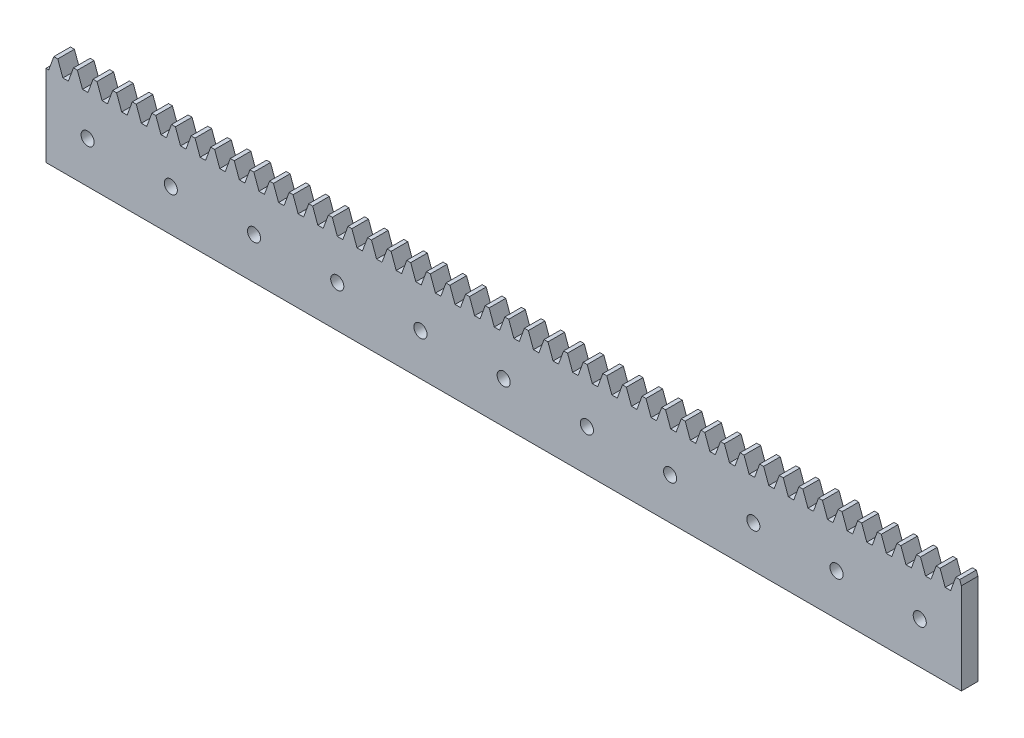
from build123d import *

# Parameters (mm, degrees)
BLANKSKE_W          = 660
BLANKSKE_H          = 23
BLANK_DEPTH         = 4
TOOTHCUTSIM_DEPTH   = 661.412749726
TEETHCUTS_COUNT     = 142
TEETHCUTS_PITCH     = 4.712388975
SKETCH_2_R          = 1.575
CUT_EXTRUDE_2_DEPTH = 661.412749726
SKETCH_3_W          = 440
SKETCH_3_H          = 65.547839675
CUT_EXTRUDE_3_DEPTH = 661.412749726


with BuildPart() as part:
    # BlankSke → Blank (new body)
    with BuildSketch(Plane.XY):
        with Locations((330, 11.5)):
            Rectangle(BLANKSKE_W, BLANKSKE_H)
    extrude(amount=-BLANK_DEPTH)

    # TooCutSkeSim → ToothCutSim (cut, through all)
    with BuildSketch(Plane.XY):
        Polygon((0.654653055, 19.625), (-0.654653055, 19.625), (-1.892297439, 23.0254), (1.892297439, 23.0254), align=None)
    toothcutsim = extrude(amount=-TOOTHCUTSIM_DEPTH, mode=Mode.SUBTRACT)

    # TeethCuts: ToothCutSim ×142
    with Locations(*[(i * TEETHCUTS_PITCH, 0, 0) for i in range(1, TEETHCUTS_COUNT)]):
        add(toothcutsim, mode=Mode.SUBTRACT)

    # 草图2 → 切除-拉伸2 (cut, through all)
    with BuildSketch(Plane.XY):
        with Locations((650, 10)):
            Circle(SKETCH_2_R)
        with Locations((630, 10)):
            Circle(SKETCH_2_R)
        with Locations((610, 10)):
            Circle(SKETCH_2_R)
        with Locations((590, 10)):
            Circle(SKETCH_2_R)
        with Locations((570, 10)):
            Circle(SKETCH_2_R)
        with Locations((550, 10)):
            Circle(SKETCH_2_R)
        with Locations((530, 10)):
            Circle(SKETCH_2_R)
        with Locations((510, 10)):
            Circle(SKETCH_2_R)
        with Locations((490, 10)):
            Circle(SKETCH_2_R)
        with Locations((470, 10)):
            Circle(SKETCH_2_R)
        with Locations((450, 10)):
            Circle(SKETCH_2_R)
        with Locations((430, 10)):
            Circle(SKETCH_2_R)
        with Locations((410, 10)):
            Circle(SKETCH_2_R)
        with Locations((390, 10)):
            Circle(SKETCH_2_R)
        with Locations((370, 10)):
            Circle(SKETCH_2_R)
        with Locations((350, 10)):
            Circle(SKETCH_2_R)
        with Locations((330, 10)):
            Circle(SKETCH_2_R)
        with Locations((310, 10)):
            Circle(SKETCH_2_R)
        with Locations((290, 10)):
            Circle(SKETCH_2_R)
        with Locations((270, 10)):
            Circle(SKETCH_2_R)
        with Locations((250, 10)):
            Circle(SKETCH_2_R)
        with Locations((230, 10)):
            Circle(SKETCH_2_R)
        with Locations((210, 10)):
            Circle(SKETCH_2_R)
        with Locations((190, 10)):
            Circle(SKETCH_2_R)
        with Locations((170, 10)):
            Circle(SKETCH_2_R)
        with Locations((150, 10)):
            Circle(SKETCH_2_R)
        with Locations((130, 10)):
            Circle(SKETCH_2_R)
        with Locations((110, 10)):
            Circle(SKETCH_2_R)
        with Locations((90, 10)):
            Circle(SKETCH_2_R)
        with Locations((70, 10)):
            Circle(SKETCH_2_R)
        with Locations((50, 10)):
            Circle(SKETCH_2_R)
        with Locations((30, 10)):
            Circle(SKETCH_2_R)
        with Locations((10, 10)):
            Circle(SKETCH_2_R)
    extrude(amount=-CUT_EXTRUDE_2_DEPTH, mode=Mode.SUBTRACT)

    # 草图3 → 切除-拉伸3 (cut, through all)
    with BuildSketch(Plane.XY):
        with Locations((440, 32.773919838)):
            Rectangle(SKETCH_3_W, SKETCH_3_H)
    extrude(amount=-CUT_EXTRUDE_3_DEPTH, mode=Mode.SUBTRACT)


solid = part.part
